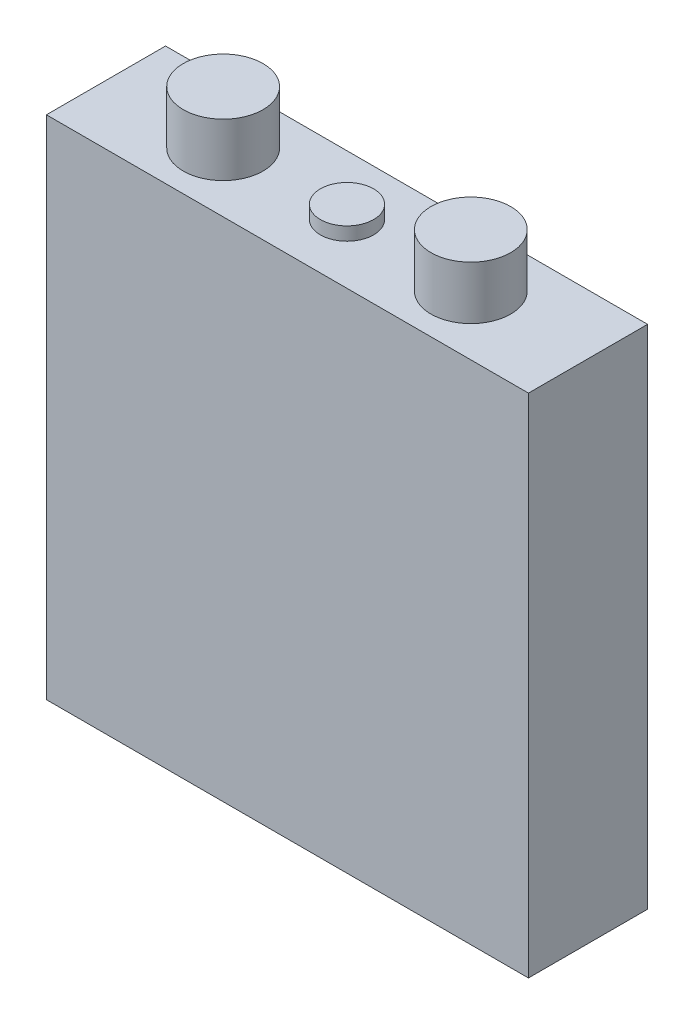
from build123d import *

# Parameters (mm, degrees)
SKETCH1_W           = 138.0236
SKETCH1_H           = 34.1122
BOSS_EXTRUDE1_DEPTH = 145.034
SKETCH2_R           = 11.43
BOSS_EXTRUDE2_DEPTH = 15.24
SKETCH3_R           = 7.62
BOSS_EXTRUDE3_DEPTH = 3.81


with BuildPart() as part:
    # Sketch1 → Boss-Extrude1 (new body)
    with BuildSketch(Plane(origin=(0, 0, 0), x_dir=(1, 0, 0), z_dir=(0, 1, 0))):
        Rectangle(SKETCH1_W, SKETCH1_H)
    extrude(amount=BOSS_EXTRUDE1_DEPTH)

    # Sketch2 → Boss-Extrude2 (add)
    with BuildSketch(Plane(origin=(0, 145.034, 0), x_dir=(1, 0, 0), z_dir=(0, 1, 0))):
        with Locations((-35.4584, 0)):
            Circle(SKETCH2_R)
        with Locations((35.4584, 0)):
            Circle(SKETCH2_R)
    extrude(amount=BOSS_EXTRUDE2_DEPTH)

    # Sketch3 → Boss-Extrude3 (add)
    with BuildSketch(Plane(origin=(0, 145.034, 0), x_dir=(1, 0, 0), z_dir=(0, 1, 0))):
        Circle(SKETCH3_R)
    extrude(amount=BOSS_EXTRUDE3_DEPTH)


solid = part.part
